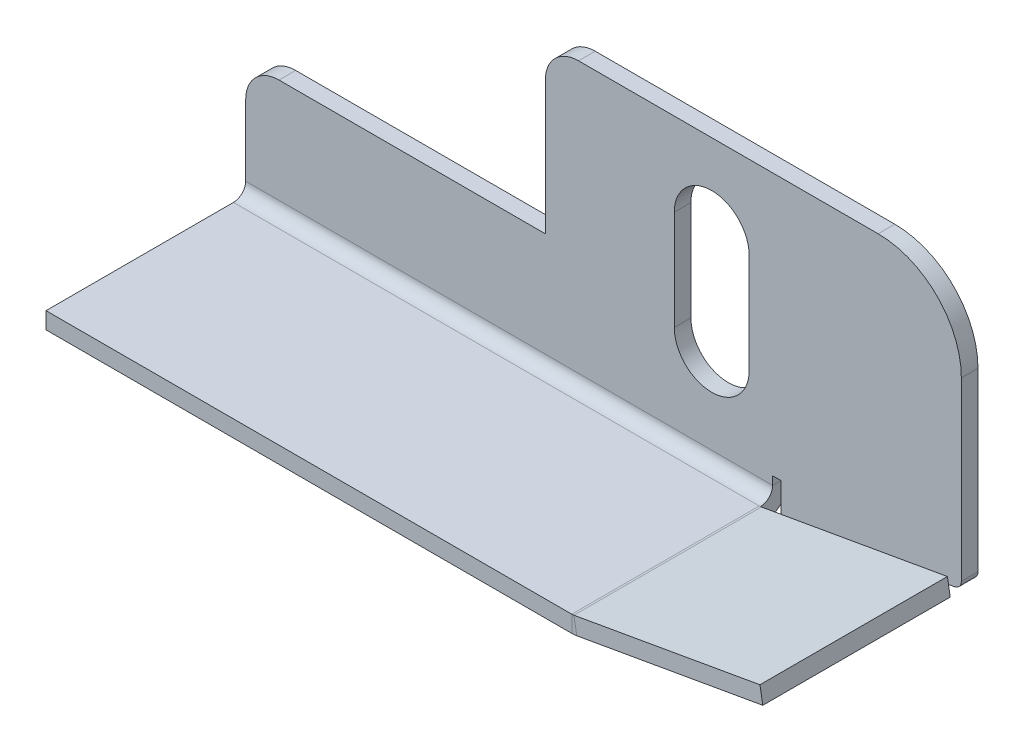
from build123d import *

# Parameters (mm, degrees)
BASIS_BLECH1_DEPTH             = 1
KANTE_LASCHE2_STRIP_W          = 5.4732
KANTE_LASCHE2_STRIP_H          = 1
KANTE_LASCHE2_STRIP_CUT_DEPTH  = 31.657436361
KANTE_LASCHE2_RELIEF_W         = 5.9732
KANTE_LASCHE2_RELIEF_H         = 0.5
KANTE_LASCHE2_RELIEF_CUT_DEPTH = 1
KANTE_LASCHE2_DEPTH            = 31.657436361
KANTE_LASCHE3_STRIP_CUT_DEPTH  = 11.2634
KANTE_LASCHE3_DEPTH            = 11.2634
VERRUNDUNG1_R                  = 0.5


# Sheet-metal steps are written as plain solids
with BuildPart() as part:
    # Skizze1 → Basis-Blech1 (new body)
    with BuildSketch(Plane.XY):
        with BuildLine():
            Line((-28.342563639, 0.5), (-60, 0.5))
            Line((-60, 0.5), (-60, 6.5))
            ThreePointArc((-60, 6.5), (-59.414213562, 7.914213562), (-58, 8.5))
            Line((-58, 8.5), (-42, 8.5))
            Line((-42, 8.5), (-42, 16.5))
            ThreePointArc((-42, 16.5), (-41.414213562, 17.914213562), (-40, 18.5))
            Line((-40, 18.5), (-22, 18.5))
            ThreePointArc((-22, 18.5), (-18.464466094, 17.035533906), (-17, 13.5))
            Line((-17, 13.5), (-17, 2.5))
            Line((-17, 2.5), (-28.342563639, 0.5))
        make_face()
        with BuildLine():
            Line((-29.75, 7.5), (-29.75, 13.5))
            ThreePointArc((-29.75, 13.5), (-32, 15.75), (-34.25, 13.5))
            Line((-34.25, 13.5), (-34.25, 7.5))
            ThreePointArc((-34.25, 7.5), (-32, 5.25), (-29.75, 7.5))
        make_face(mode=Mode.SUBTRACT)
    extrude(amount=BASIS_BLECH1_DEPTH)

    # Kante-Lasche2 strip (across the edge) → Kante-Lasche2 strip cut (cut)
    with BuildSketch(Plane(origin=(-60, 0.5, 1), x_dir=(0, 1, 0), z_dir=(1, 0, 0))):
        with Locations((-1, -0.5)):
            Rectangle(KANTE_LASCHE2_STRIP_W, KANTE_LASCHE2_STRIP_H)
    extrude(amount=KANTE_LASCHE2_STRIP_CUT_DEPTH, mode=Mode.SUBTRACT)

    # Kante-Lasche2 relief (on the sheet) → Kante-Lasche2 relief cut (cut)
    with BuildSketch(Plane(origin=(-60, 2.2366, 1), x_dir=(0, 1, 0), z_dir=(0, 0, 1))):
        with Locations((-2.4866, -31.907436361)):
            Rectangle(KANTE_LASCHE2_RELIEF_W, KANTE_LASCHE2_RELIEF_H)
    extrude(amount=-KANTE_LASCHE2_RELIEF_CUT_DEPTH, mode=Mode.SUBTRACT)

    # Kante-Lasche2 section (across the edge) → Kante-Lasche2 (add)
    with BuildSketch(Plane(origin=(-60, 0.5, 1), x_dir=(0, 1, 0), z_dir=(1, 0, 0))):
        with BuildLine():
            Line((0, 0.7366), (0, 12))
            Line((0, 12), (1, 12))
            Line((1, 12), (1, 0.7366))
            ThreePointArc((1, 0.7366), (1.215745145, 0.215745145), (1.7366, 0))
            Line((1.7366, 0), (1.7366, -1))
            ThreePointArc((1.7366, -1), (0.508638364, -0.491361636), (0, 0.7366))
        make_face()
    extrude(amount=KANTE_LASCHE2_DEPTH)

    # Kante-Lasche3 strip (across the edge) → Kante-Lasche3 strip cut (cut)
    with BuildSketch(Plane(origin=(-28.342563639, 1.5, 13), x_dir=(-0.1736481776669238, 0.9848077530122092, 3.1093246385391698e-15), z_dir=(0, 0, -1))):
        Polygon((-1.92402835, 5.152936518), (-0.973617144, -0.237113276), (0.011190609, -0.063465098), (-0.939220597, 5.326584696), align=None)
    extrude(amount=KANTE_LASCHE3_STRIP_CUT_DEPTH, mode=Mode.SUBTRACT)

    # Kante-Lasche3 section (across the edge) → Kante-Lasche3 (add)
    with BuildSketch(Plane(origin=(-28.342563639, 1.5, 13), x_dir=(-0.1736481776669238, 0.9848077530122092, 3.1093246385391698e-15), z_dir=(0, 0, -1))):
        with BuildLine():
            Line((-1, 0.06444415), (-1, 11.412511336))
            Line((-1, 11.412511336), (0, 11.412511336))
            Line((0, 11.412511336), (0, 0.06444415))
            ThreePointArc((0, 0.06444415), (0.002802985, 0.000245229), (0.011190609, -0.063465098))
            Line((0.011190609, -0.063465098), (-0.973617144, -0.237113276))
            ThreePointArc((-0.973617144, -0.237113276), (-0.993391713, -0.086910513), (-1, 0.06444415))
        make_face()
    extrude(amount=KANTE_LASCHE3_DEPTH)

    # Verrundung1
    verrundung1_edges = [part.edges().sort_by_distance(p)[0] for p in [
        (-17, 2.5, 0.5),
        (-27.842563639, 0.58816349, 0.5),
    ]]
    fillet(verrundung1_edges, radius=VERRUNDUNG1_R)


solid = part.part
